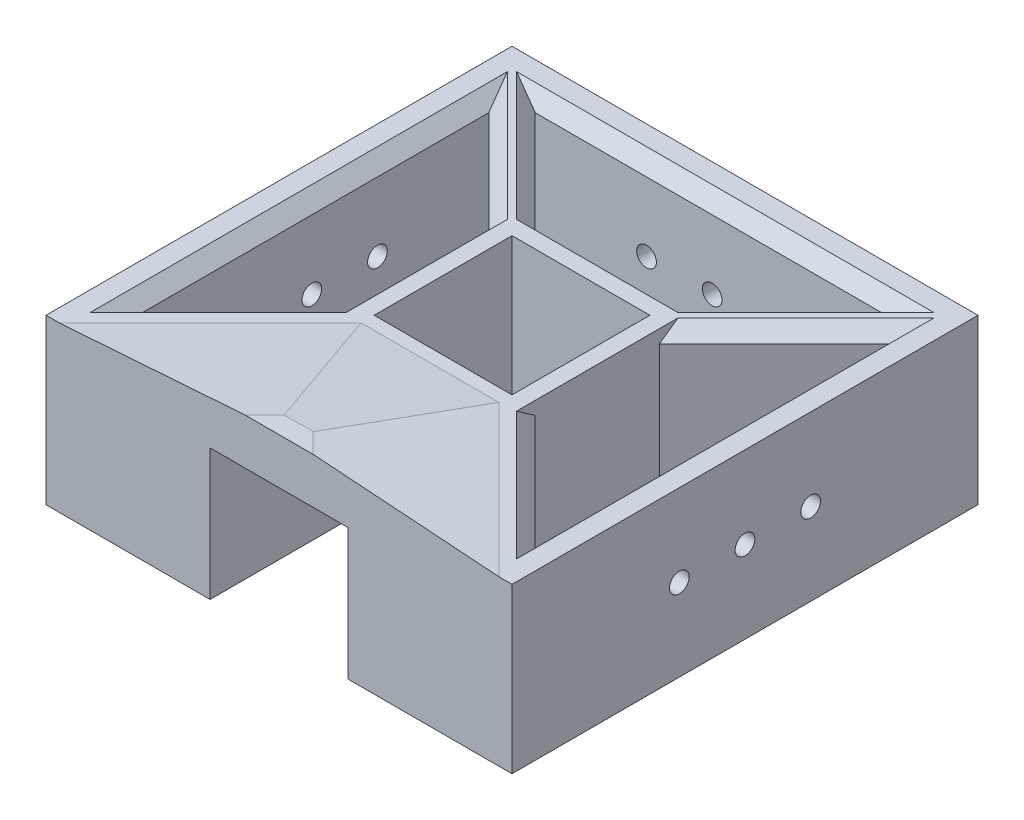
from build123d import *
from OCP.BRepFilletAPI import BRepFilletAPI_MakeChamfer

# Parameters (mm, degrees)
SKETCH1_W               = 71
SKETCH1_H               = 71
SKETCH1_W_2             = 21
SKETCH1_H_2             = 21
BOSS_EXTRUDE1_DEPTH     = 25
SKETCH2_W               = 21
SKETCH2_H               = 23
BOSS_EXTRUDE2_DEPTH     = 2
CHAMFER1_SIZE           = 2
CHAMFER1_SIZE_2         = 20
CUT_EXTRUDE1_DEPTH      = 84.846586096
CUT_EXTRUDE1_DEPTH_BACK = 5
SKETCH3_R               = 1.5
SKETCH4_R               = 1.5
CUT_EXTRUDE2_DEPTH      = 5
CUT_EXTRUDE3_START      = -5
SKETCH5_R               = 1.5
CUT_EXTRUDE3_DEPTH      = 5
SKETCH6_W               = 21
SKETCH6_H               = 20
SKETCH6_R               = 2.5
CUT_EXTRUDE4_DEPTH      = 21
CUT_EXTRUDE5_DEPTH      = 30
CHAMFER2_SIZE           = 2


with BuildPart() as part:
    # Sketch1 → Boss-Extrude1 (new body)
    with BuildSketch(Plane(origin=(0, 0, 0), x_dir=(1, 0, 0), z_dir=(0, 1, 0))):
        Rectangle(SKETCH1_W, SKETCH1_H)
        Polygon((-13, 9.464466094), (-13, -9.464466094), (-30.5, -26.964466094), (-30.5, 26.964466094), align=None, mode=Mode.SUBTRACT)
        Rectangle(SKETCH1_W_2, SKETCH1_H_2, mode=Mode.SUBTRACT)
        Polygon((30.5, -26.964466094), (13, -9.464466094), (13, 9.464466094), (30.5, 26.964466094), align=None, mode=Mode.SUBTRACT)
        Polygon((9.464466094, 13), (-9.464466094, 13), (-26.964466094, 30.5), (26.964466094, 30.5), align=None, mode=Mode.SUBTRACT)
    extrude(amount=BOSS_EXTRUDE1_DEPTH)

    # Sketch2 → Boss-Extrude2 (add)
    with BuildSketch(Plane(origin=(0, 25, 0), x_dir=(1, 0, 0), z_dir=(0, 1, 0))):
        Polygon((-33.5, -35.5), (-10.5, -35.5), (-10.5, -12.5), align=None)
        with Locations((0, -24)):
            Rectangle(SKETCH2_W, SKETCH2_H)
        Polygon((10.5, -12.5), (10.5, -35.5), (33.5, -35.5), align=None)
    extrude(amount=BOSS_EXTRUDE2_DEPTH)

    # Chamfer1
    chamfer1_edges_1 = [part.edges().sort_by_distance(p)[0] for p in [
        (22, 27, 24),
    ]]
    chamfer1_side_1 = [part.faces().sort_by_distance(p)[0] for p in [
        (22, 26.96, 24),
    ]]
    chamfer1_edges_2 = [part.edges().sort_by_distance(p)[0] for p in [
        (0, 27, 12.5),
    ]]
    chamfer1_side_2 = [part.faces().sort_by_distance(p)[0] for p in [
        (0, 26.96, 12.5),
    ]]
    chamfer1_edges_3 = [part.edges().sort_by_distance(p)[0] for p in [
        (-22, 27, 24),
    ]]
    chamfer1_side_3 = [part.faces().sort_by_distance(p)[0] for p in [
        (-22, 26.96, 24),
    ]]
    chamfer1 = BRepFilletAPI_MakeChamfer(part.part.solid().wrapped)
    for e in chamfer1_edges_1:
        chamfer1.Add(CHAMFER1_SIZE - 0.0001, CHAMFER1_SIZE_2 - 0.0001, e.wrapped, chamfer1_side_1[0].wrapped)
    for e in chamfer1_edges_2:
        chamfer1.Add(CHAMFER1_SIZE - 0.0001, CHAMFER1_SIZE_2 - 0.0001, e.wrapped, chamfer1_side_2[0].wrapped)
    for e in chamfer1_edges_3:
        chamfer1.Add(CHAMFER1_SIZE - 0.0001, CHAMFER1_SIZE_2 - 0.0001, e.wrapped, chamfer1_side_3[0].wrapped)
    add(Compound.cast(chamfer1.Shape()), mode=Mode.REPLACE)  # a hair under: the kernel refuses the full size

    # Sketch3 → Cut-Extrude1 (cut, two sides: drawn at the far end of the back side and taken through both)
    with BuildSketch(Plane.ZY.offset(35.5).offset(-CUT_EXTRUDE1_DEPTH_BACK)):
        with Locations(Location((-10, 12.5, 0), (0, 0, 180))):
            Circle(SKETCH3_R)
        with BuildLine():
            ThreePointArc((0, 14), (-1.5, 12.5), (0, 11))
            Line((0, 11), (0, 14))
        make_face()
        with BuildLine():
            Line((0, 14), (0, 11))
            ThreePointArc((0, 11), (1.060660172, 11.439339828), (1.5, 12.5))
            ThreePointArc((1.5, 12.5), (1.060660172, 13.560660172), (0, 14))
        make_face()
        with Locations(Location((10, 12.5, 0), (0, 0, 180))):
            Circle(SKETCH3_R)
    extrude(amount=CUT_EXTRUDE1_DEPTH + CUT_EXTRUDE1_DEPTH_BACK, mode=Mode.SUBTRACT)

    # Sketch4 → Cut-Extrude2 (cut)
    with BuildSketch(Plane(origin=(0, 0, -35.5), x_dir=(-1, 0, 0), z_dir=(0, 0, -1))):
        with Locations((-10, 12.5)):
            Circle(SKETCH4_R)
        with Locations((0, 12.5)):
            Circle(SKETCH4_R)
        with Locations((10, 12.5)):
            Circle(SKETCH4_R)
    extrude(amount=-CUT_EXTRUDE2_DEPTH, mode=Mode.SUBTRACT)

    # Sketch5 → Cut-Extrude3 (cut)
    with BuildSketch(Plane(origin=(35.5, 0, 0), x_dir=(0, 0, -1), z_dir=(1, 0, 0)).offset(CUT_EXTRUDE3_START)):
        with Locations((-10, 12.5)):
            Circle(SKETCH5_R)
        with BuildLine():
            ThreePointArc((1.5, 12.5), (1.060660172, 13.560660172), (0, 14))
            Line((0, 14), (0, 11))
            ThreePointArc((0, 11), (1.060660172, 11.439339828), (1.5, 12.5))
        make_face()
        with BuildLine():
            Line((0, 11), (0, 14))
            ThreePointArc((0, 14), (-1.5, 12.5), (0, 11))
        make_face()
        with Locations((10, 12.5)):
            Circle(SKETCH5_R)
    extrude(amount=CUT_EXTRUDE3_DEPTH, mode=Mode.SUBTRACT)

    # Sketch6 → Cut-Extrude4 (cut)
    with BuildSketch(Plane.XY.offset(35.5)):
        with Locations((0, 10)):
            Rectangle(SKETCH6_W, SKETCH6_H)
        with Locations((0, 10)):
            Circle(SKETCH6_R, mode=Mode.SUBTRACT)
    extrude(amount=-CUT_EXTRUDE4_DEPTH, mode=Mode.SUBTRACT)

    # Sketch6<2> → Cut-Extrude5 (cut)
    with BuildSketch(Plane.XY.offset(35.5)):
        with BuildLine():
            ThreePointArc((0, 12.5), (-2.5, 10), (0, 7.5))
            Line((0, 7.5), (0, 12.5))
        make_face()
        with BuildLine():
            Line((0, 12.5), (0, 7.5))
            ThreePointArc((0, 7.5), (1.767766953, 8.232233047), (2.5, 10))
            ThreePointArc((2.5, 10), (1.767766953, 11.767766953), (0, 12.5))
        make_face()
    extrude(amount=-CUT_EXTRUDE5_DEPTH, mode=Mode.SUBTRACT)

    # Chamfer2
    chamfer2_edges = [part.edges().sort_by_distance(p)[0] for p in [
        (-18.214466094, 25, -21.75),
        (-30.5, 25, 0),
        (-21.75, 25, -18.214466094),
        (-21.75, 25, 18.214466094),
        (0, 25, -30.5),
        (30.5, 25, 0),
        (21.75, 25, 18.214466094),
        (18.214466094, 25, -21.75),
        (21.75, 25, -18.214466094),
    ]]
    chamfer(chamfer2_edges, length=CHAMFER2_SIZE)


solid = part.part
